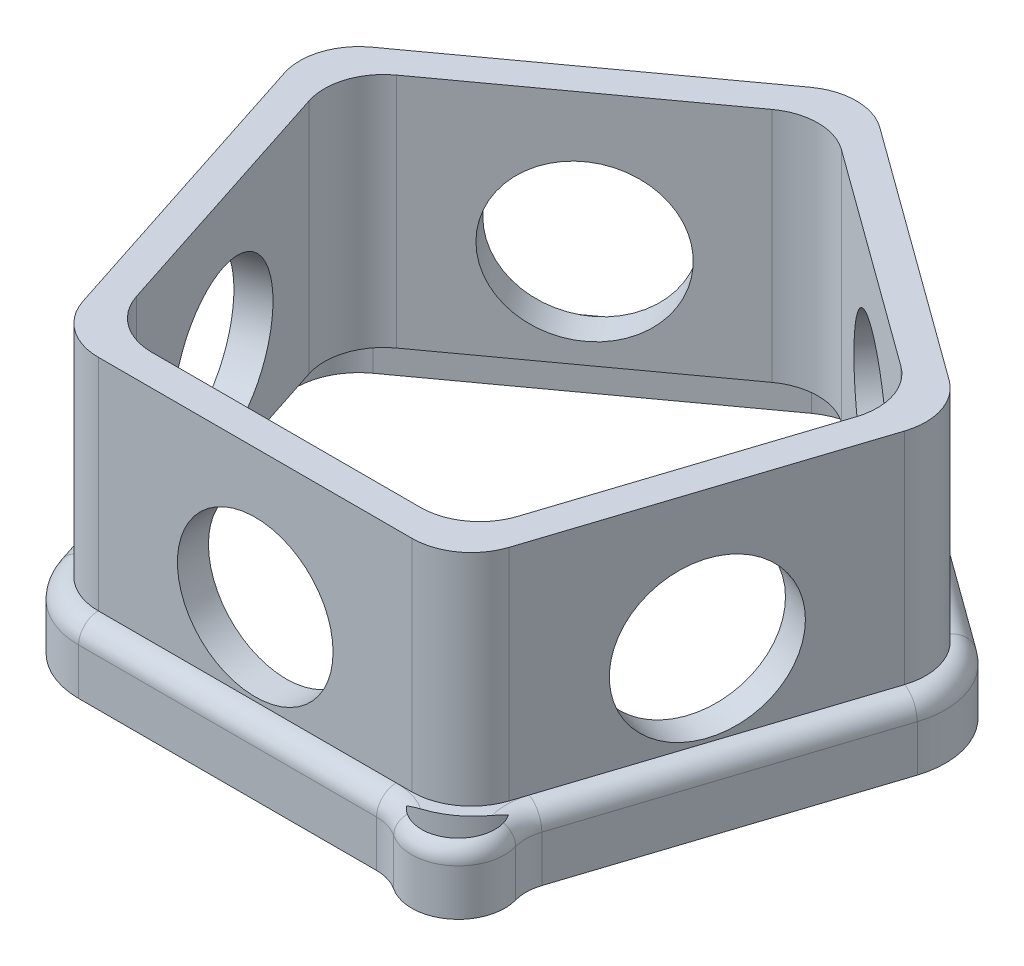
from build123d import *

# Parameters (mm, degrees)
SKETCH1_W                = 45.72
SKETCH1_H                = 25.4
SKETCH1_R                = 9.75
BOSS_EXTRUDE1_DEPTH      = 4
BOSS_EXTRUDE2_DEPTH      = 25.4
SKETCH3_R                = 10.033
CUT_EXTRUDE1_DEPTH       = 11.62
CIRPATTERN1_COUNT        = 5
FILLET1_R                = 7.62
BOSS_EXTRUDE3_DEPTH      = 5.08
BOSS_EXTRUDE4_DEPTH      = 6.35
BOSS_EXTRUDE4_DEPTH_BACK = 2.159
BOSS_EXTRUDE5_START      = -8.509
BOSS_EXTRUDE5_DEPTH      = 8.509
CUT_EXTRUDE4_DEPTH       = 12.192
FILLET5_R                = 5.715
FILLET6_R                = 2.54
CUT_EXTRUDE5_DEPTH       = 6.35


with BuildPart() as part:
    # Sketch1 → Boss-Extrude1 (new body)
    with BuildSketch(Plane.XY):
        Rectangle(SKETCH1_W, SKETCH1_H)
        Circle(SKETCH1_R, mode=Mode.SUBTRACT)
    extrude(amount=BOSS_EXTRUDE1_DEPTH)

    # Sketch2 → Boss-Extrude2 (add)
    with BuildSketch(Plane(origin=(0, 12.7, 0), x_dir=(1, 0, 0), z_dir=(0, 1, 0))):
        Polygon((36.988256983, 43.482303925), (22.86, 0), (22.86, -4), (25.766170112, -4), (41.690539001, 45.01016797), (0, 75.30011757), (-41.690539001, 45.01016797), (-25.766170112, -4), (-22.86, -4), (-22.86, 0), (-36.988256983, 43.482303925), (0, 70.35584566), align=None)
    extrude(amount=-BOSS_EXTRUDE2_DEPTH)

    # Sketch3 → Cut-Extrude1 (cut)
    with BuildSketch(Plane.XY.offset(4)):
        Circle(SKETCH3_R)
    cut_extrude1 = extrude(amount=-CUT_EXTRUDE1_DEPTH, mode=Mode.SUBTRACT)

    # CirPattern1: Cut-Extrude1 ×5 about axis
    cirpattern1_axis = Axis((0, 12.7, -31.513299997), (0, -1, 0))
    for i in range(1, CIRPATTERN1_COUNT):
        add(cut_extrude1.rotate(cirpattern1_axis, i * 360 / CIRPATTERN1_COUNT), mode=Mode.SUBTRACT)

    # Fillet1
    fillet1_edges = [part.edges().sort_by_distance(p)[0] for p in [
        (0, 0, -75.30011757),
        (41.690539001, 0, -45.01016797),
        (25.766170112, 0, 4),
        (36.988256983, 0, -43.482303925),
        (0, 0, -70.35584566),
        (-36.988256983, 0, -43.482303925),
        (-25.766170112, 0, 4),
        (-41.690539001, 0, -45.01016797),
        (-22.86, 0, 0),
        (22.86, 0, 0),
    ]]
    fillet(fillet1_edges, radius=FILLET1_R)

    # Sketch6 → Boss-Extrude3 (add)
    with BuildSketch(Plane(origin=(0, 12.7, 0), x_dir=(1, 0, 0), z_dir=(0, 1, 0))):
        with BuildLine():
            Line((-20.229916049, -4), (20.229916049, -4))
            ThreePointArc((20.229916049, -4), (24.708839671, -2.544709497), (27.476966703, 1.265290503))
            Line((27.476966703, 1.265290503), (39.97974241, 39.744877467))
            ThreePointArc((39.97974241, 39.744877467), (39.97974241, 44.454296461), (37.211615379, 48.264296461))
            Line((37.211615379, 48.264296461), (4.478923622, 72.045989078))
            ThreePointArc((4.478923622, 72.045989078), (0, 73.501279581), (-4.478923622, 72.045989078))
            Line((-4.478923622, 72.045989078), (-37.211615379, 48.264296461))
            ThreePointArc((-37.211615379, 48.264296461), (-39.97974241, 44.454296461), (-39.97974241, 39.744877467))
            Line((-39.97974241, 39.744877467), (-27.476966703, 1.265290503))
            ThreePointArc((-27.476966703, 1.265290503), (-24.708839671, -2.544709497), (-20.229916049, -4))
        make_face()
        with BuildLine():
            Line((24.570796591, 5.265290503), (35.277460392, 38.217013422))
            ThreePointArc((35.277460392, 38.217013422), (35.277460392, 42.926432416), (32.50933336, 46.736432416))
            Line((32.50933336, 46.736432416), (4.478923622, 67.101717168))
            ThreePointArc((4.478923622, 67.101717168), (0, 68.557007671), (-4.478923622, 67.101717168))
            Line((-4.478923622, 67.101717168), (-32.50933336, 46.736432416))
            ThreePointArc((-32.50933336, 46.736432416), (-35.277460392, 42.926432416), (-35.277460392, 38.217013422))
            Line((-35.277460392, 38.217013422), (-24.570796591, 5.265290503))
            ThreePointArc((-24.570796591, 5.265290503), (-21.802669559, 1.455290503), (-17.323745937, 0))
            Line((-17.323745937, 0), (17.323745937, 0))
            ThreePointArc((17.323745937, 0), (21.802669559, 1.455290503), (24.570796591, 5.265290503))
        make_face(mode=Mode.SUBTRACT)
    extrude(amount=BOSS_EXTRUDE3_DEPTH)

    # Sketch8 → Boss-Extrude4 (add, two sides: drawn at the far end of the back side and taken through both)
    with BuildSketch(Plane.XZ.offset(12.7).offset(-BOSS_EXTRUDE4_DEPTH_BACK)):
        with BuildLine():
            Line((5.971898163, -74.100892244), (38.70458992, -50.319199627))
            ThreePointArc((38.70458992, -50.319199627), (42.395425962, -45.239199627), (42.395425962, -38.959974301))
            Line((42.395425962, -38.959974301), (29.892650254, -0.480387337))
            ThreePointArc((29.892650254, -0.480387337), (26.201814212, 4.599612663), (20.229916049, 6.54))
            Line((20.229916049, 6.54), (-20.229916049, 6.54))
            ThreePointArc((-20.229916049, 6.54), (-26.201814212, 4.599612663), (-29.892650254, -0.480387337))
            Line((-29.892650254, -0.480387337), (-42.395425962, -38.959974301))
            ThreePointArc((-42.395425962, -38.959974301), (-42.395425962, -45.239199627), (-38.70458992, -50.319199627))
            Line((-38.70458992, -50.319199627), (-5.971898163, -74.100892244))
            ThreePointArc((-5.971898163, -74.100892244), (0, -76.041279581), (5.971898163, -74.100892244))
        make_face()
        with BuildLine():
            Line((39.97974241, -39.744877467), (27.476966703, -1.265290503))
            ThreePointArc((27.476966703, -1.265290503), (24.708839671, 2.544709497), (20.229916049, 4))
            Line((20.229916049, 4), (-20.229916049, 4))
            ThreePointArc((-20.229916049, 4), (-24.708839671, 2.544709497), (-27.476966703, -1.265290503))
            Line((-27.476966703, -1.265290503), (-39.97974241, -39.744877467))
            ThreePointArc((-39.97974241, -39.744877467), (-39.97974241, -44.454296461), (-37.211615379, -48.264296461))
            Line((-37.211615379, -48.264296461), (-4.478923622, -72.045989078))
            ThreePointArc((-4.478923622, -72.045989078), (0, -73.501279581), (4.478923622, -72.045989078))
            Line((4.478923622, -72.045989078), (37.211615379, -48.264296461))
            ThreePointArc((37.211615379, -48.264296461), (39.97974241, -44.454296461), (39.97974241, -39.744877467))
        make_face(mode=Mode.SUBTRACT)
    extrude(amount=BOSS_EXTRUDE4_DEPTH + BOSS_EXTRUDE4_DEPTH_BACK)

    # Sketch11 → Boss-Extrude5 (add)
    with BuildSketch(Plane.XZ.offset(19.05).offset(BOSS_EXTRUDE5_START)):
        with BuildLine():
            Line((19.948787859, 5.414930333), (27.190045273, 1.56775587))
            Line((27.190045273, 1.56775587), (29.892650254, -0.480387337))
            ThreePointArc((29.892650254, -0.480387337), (26.201814212, 4.599612663), (20.229916049, 6.54))
            Line((20.229916049, 6.54), (19.948787859, 5.414930333))
        make_face()
        with BuildLine():
            ThreePointArc((20.229916049, 6.54), (28.196740294, 7.345392854), (29.892650254, -0.480387337))
            ThreePointArc((29.892650254, -0.480387337), (26.201814212, 4.599612663), (20.229916049, 6.54))
        make_face()
    extrude(amount=BOSS_EXTRUDE5_DEPTH)

    # Sketch12 → Cut-Extrude4 (cut)
    with BuildSketch(Plane.XZ.offset(19.05)):
        with BuildLine():
            ThreePointArc((28.787792432, 0.145862767), (27.450253023, 6.317941272), (21.166935135, 5.682739694))
            ThreePointArc((21.166935135, 5.682739694), (25.637505825, 3.822908801), (28.787792432, 0.145862767))
        make_face()
    extrude(amount=-CUT_EXTRUDE4_DEPTH, mode=Mode.SUBTRACT)

    # Fillet5
    fillet5_edges = [part.edges().sort_by_distance(p)[0] for p in [
        (20.229916049, -14.7955, 6.54),
        (29.892650254, -14.7955, -0.480387337),
    ]]
    fillet(fillet5_edges, radius=FILLET5_R)

    # Fillet6
    # the kernel refuses this fillet: 2.54 mm, written as the material it takes off along each edge
    with BuildSketch(Plane(origin=(32.732691756, -10.541, -42.099586964), x_dir=(0.5877852522924727, 0, -0.8090169943749478), z_dir=(-0.8090169943749478, 0, -0.5877852522924727))) as fillet6_piece_1:
        with BuildLine():
            CenterArc((10.16 - FILLET6_R, FILLET6_R), FILLET6_R, 270, 90)
            Line((10.16 - FILLET6_R, 0), (10.16, 0))
            Line((10.16, 0), (10.16, FILLET6_R))
        make_face()
    revolve(axis=Axis((32.732691756, -10.541, -42.099586964), (0, -1, 0)), revolution_arc=72, mode=Mode.SUBTRACT)
    with BuildSketch(Plane(origin=(5.971898163, -10.541, -74.100892244), x_dir=(0, -1, 0), z_dir=(0.8090169943749487, 0, 0.5877852522924716)), Plane(origin=(-38.70458992, -10.541, -50.319199627), x_dir=(0, -1, 0), z_dir=(0.8090169943749469, 0, -0.5877852522924739)), Plane(origin=(-29.892650254, -10.541, -0.480387337), x_dir=(0, -1, 0), z_dir=(-0.30901699437495056, 0, -0.9510565162951526))) as fillet6_piece_2:
        with BuildLine():
            CenterArc((FILLET6_R, -FILLET6_R), FILLET6_R, 90, 90)
            Line((0, -FILLET6_R), (0, 0))
            Line((0, 0), (FILLET6_R, 0))
        make_face()
    extrude(amount=40.459832097, mode=Mode.SUBTRACT)
    with BuildSketch(Plane(origin=(0, -10.541, -65.881279581), x_dir=(-0.5877852522924719, 0, -0.8090169943749482), z_dir=(-0.8090169943749482, 0, 0.5877852522924719))) as fillet6_piece_3:
        with BuildLine():
            CenterArc((10.16 - FILLET6_R, FILLET6_R), FILLET6_R, 270, 90)
            Line((10.16 - FILLET6_R, 0), (10.16, 0))
            Line((10.16, 0), (10.16, FILLET6_R))
        make_face()
    revolve(axis=Axis((0, -10.541, -65.881279581), (0, -1, 0)), revolution_arc=72, mode=Mode.SUBTRACT)
    with BuildSketch(Plane(origin=(-32.732691756, -10.541, -42.099586964), x_dir=(-0.9510565162951528, 0, 0.3090169943749496), z_dir=(0.3090169943749496, 0, 0.9510565162951528))) as fillet6_piece_4:
        with BuildLine():
            CenterArc((10.16 - FILLET6_R, FILLET6_R), FILLET6_R, 270, 90)
            Line((10.16 - FILLET6_R, 0), (10.16, 0))
            Line((10.16, 0), (10.16, FILLET6_R))
        make_face()
    revolve(axis=Axis((-32.732691756, -10.541, -42.099586964), (0, -1, 0)), revolution_arc=72, mode=Mode.SUBTRACT)
    with BuildSketch(Plane(origin=(-20.229916049, -10.541, -3.62), x_dir=(0, 0, 1), z_dir=(1, 0, 0))) as fillet6_piece_5:
        with BuildLine():
            CenterArc((10.16 - FILLET6_R, FILLET6_R), FILLET6_R, 270, 90)
            Line((10.16 - FILLET6_R, 0), (10.16, 0))
            Line((10.16, 0), (10.16, FILLET6_R))
        make_face()
    revolve(axis=Axis((-20.229916049, -10.541, -3.62), (0, -1, 0)), revolution_arc=72, mode=Mode.SUBTRACT)
    with BuildSketch(Plane(origin=(18.184374257, -10.541, 6.54), x_dir=(0, -1, 0), z_dir=(-1, 0, 0)), Plane(origin=(42.395425962, -10.541, -38.959974301), x_dir=(0, -1, 0), z_dir=(-0.30901699437494484, 0, 0.9510565162951544))) as fillet6_piece_6:
        with BuildLine():
            CenterArc((FILLET6_R, -FILLET6_R), FILLET6_R, 90, 90)
            Line((0, -FILLET6_R), (0, 0))
            Line((0, 0), (FILLET6_R, 0))
        make_face()
    extrude(amount=38.414290306, mode=Mode.SUBTRACT)
    with BuildSketch(Plane(origin=(18.184374257, -10.541, 12.255), x_dir=(0.5526465683039506, 0, -0.8334157249187628), z_dir=(0.8334157249187628, 0, 0.5526465683039506))) as fillet6_piece_7:
        with BuildLine():
            CenterArc((5.715 + FILLET6_R, -FILLET6_R), FILLET6_R, 90, 90)
            Line((5.715 + FILLET6_R, 0), (5.715, 0))
            Line((5.715, 0), (5.715, -FILLET6_R))
        make_face()
    revolve(axis=Axis((18.184374257, -10.541, 12.255), (0, 1, 0)), revolution_arc=33.548768752, mode=Mode.SUBTRACT)
    with BuildSketch(Plane(origin=(35.960045421, -10.541, -0.659781065), x_dir=(-0.9510565162951543, 0, -0.30901699437494495), z_dir=(0.30901699437494495, 0, -0.9510565162951543))) as fillet6_piece_8:
        with BuildLine():
            CenterArc((5.715 + FILLET6_R, -FILLET6_R), FILLET6_R, 90, 90)
            Line((5.715 + FILLET6_R, 0), (5.715, 0))
            Line((5.715, 0), (5.715, -FILLET6_R))
        make_face()
    revolve(axis=Axis((35.960045421, -10.541, -0.659781065), (0, 1, 0)), revolution_arc=33.548768752, mode=Mode.SUBTRACT)
    with BuildSketch(Plane(origin=(24.664153166, -10.541, 2.483203799), x_dir=(-0.5526465683039513, 0, 0.8334157249187624), z_dir=(-0.8334157249187624, 0, -0.5526465683039513))) as fillet6_piece_9:
        with BuildLine():
            CenterArc((6.009996192 - FILLET6_R, -FILLET6_R), FILLET6_R, 0, 90)
            Line((6.009996192 - FILLET6_R, 0), (6.009996192, 0))
            Line((6.009996192, 0), (6.009996192, -FILLET6_R))
        make_face()
    revolve(axis=Axis((24.664153166, -10.541, 2.483203799), (0, 1, 0)), revolution_arc=139.097537505, mode=Mode.SUBTRACT)

    # Sketch13 → Cut-Extrude5 (cut)
    # profile 1 of 2: a face of its own
    with BuildSketch(Plane.XZ.offset(19.05)):
        with BuildLine():
            Line((20.229916049, 4.6), (-20.229916049, 4.6))
            ThreePointArc((-20.229916049, 4.6), (-25.061510822, 3.030119694), (-28.047600613, -1.079880306))
            Line((-28.047600613, -1.079880306), (-40.55037632, -39.559467271))
            ThreePointArc((-40.55037632, -39.559467271), (-40.55037632, -44.639706658), (-37.56428653, -48.749706658))
            Line((-37.56428653, -48.749706658), (-4.831594774, -72.531399275))
            ThreePointArc((-4.831594774, -72.531399275), (0, -74.101279581), (4.831594774, -72.531399275))
            Line((4.831594774, -72.531399275), (37.56428653, -48.749706658))
            ThreePointArc((37.56428653, -48.749706658), (40.55037632, -44.639706658), (40.55037632, -39.559467271))
            Line((40.55037632, -39.559467271), (28.047600613, -1.079880306))
            ThreePointArc((28.047600613, -1.079880306), (25.061510822, 3.030119694), (20.229916049, 4.6))
        make_face()
        with BuildLine():
            Line((39.97974241, -39.744877467), (27.476966703, -1.265290503))
            ThreePointArc((27.476966703, -1.265290503), (24.708839671, 2.544709497), (20.229916049, 4))
            Line((20.229916049, 4), (-20.229916049, 4))
            ThreePointArc((-20.229916049, 4), (-24.708839671, 2.544709497), (-27.476966703, -1.265290503))
            Line((-27.476966703, -1.265290503), (-39.97974241, -39.744877467))
            ThreePointArc((-39.97974241, -39.744877467), (-39.97974241, -44.454296461), (-37.211615379, -48.264296461))
            Line((-37.211615379, -48.264296461), (-4.478923622, -72.045989078))
            ThreePointArc((-4.478923622, -72.045989078), (0, -73.501279581), (4.478923622, -72.045989078))
            Line((4.478923622, -72.045989078), (37.211615379, -48.264296461))
            ThreePointArc((37.211615379, -48.264296461), (39.97974241, -44.454296461), (39.97974241, -39.744877467))
        make_face(mode=Mode.SUBTRACT)
    # profile 2 of 2: a face of its own
    with BuildSketch(Plane.XZ.offset(19.05)):
        with BuildLine():
            ThreePointArc((28.787792432, 0.145862767), (27.450253023, 6.317941272), (21.166935135, 5.682739694))
            ThreePointArc((21.166935135, 5.682739694), (25.637505825, 3.822908801), (28.787792432, 0.145862767))
        make_face()
    extrude(amount=-CUT_EXTRUDE5_DEPTH, mode=Mode.SUBTRACT)


solid = part.part
